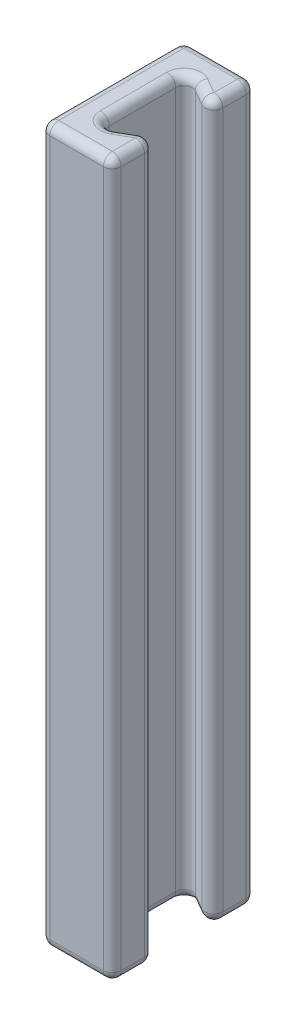
from build123d import *
from OCP.BRepFilletAPI import BRepFilletAPI_MakeFillet

# Parameters (mm, degrees)
BOSS_EXTRUDE2_DEPTH = 127
FILLET1_R1          = 1.5875
FILLET1_R2          = 1.4732


with BuildPart() as part:
    # Sketch1 → Boss-Extrude2 (new body)
    with BuildSketch(Plane(origin=(0, 0, 0), x_dir=(1, 0, 0), z_dir=(0, 1, 0))):
        Polygon((-28.067579909, 0), (-28.067579909, -25.4), (-15.367579909, -25.4), (-15.367579909, -16.933333333), (-22.699928279, -21.166666582), (-22.699928279, -4.233333249), (-15.367579909, -8.466666667), (-15.367579909, 0), align=None)
    extrude(amount=BOSS_EXTRUDE2_DEPTH)

    # Fillet1: one fillet with a radius per group of edges: ONE call of the kernel's fillet builder (fillet() takes one radius for all edges)
    fillet1_edges_1 = [part.edges().sort_by_distance(p)[0] for p in [
        (-19.033754094, 127, 6.349999958),
        (-22.699928279, 127, 12.699999915),
        (-19.033754094, 127, 19.049999958),
        (-15.367579909, 127, 21.166666667),
        (-15.367579909, 127, 4.233333333),
        (-21.717579909, 127, 0),
        (-28.067579909, 63.5, 0),
        (-15.367579909, 63.5, 0),
        (-21.717579909, 0, 0),
        (-15.367579909, 0, 4.233333333),
        (-15.367579909, 63.5, 8.466666667),
        (-15.367579909, 63.5, 16.933333333),
        (-15.367579909, 0, 21.166666667),
        (-15.367579909, 63.5, 25.4),
        (-22.699928279, 0, 12.699999915),
        (-28.067579909, 127, 12.7),
        (-21.717579909, 127, 25.4),
        (-28.067579909, 63.5, 25.4),
        (-28.067579909, 0, 12.7),
        (-21.717579909, 0, 25.4),
        (-19.033754094, 0, 6.349999958),
        (-19.033754094, 0, 19.049999958),
    ]]
    fillet1_edges_2 = [part.edges().sort_by_distance(p)[0] for p in [
        (-22.699928279, 63.5, 4.233333249),
        (-22.699928279, 63.5, 21.166666582),
    ]]
    fillet1 = BRepFilletAPI_MakeFillet(part.part.solid().wrapped)
    for e in fillet1_edges_1:
        fillet1.Add(FILLET1_R1, e.wrapped)
    for e in fillet1_edges_2:
        fillet1.Add(FILLET1_R2, e.wrapped)
    add(Compound.cast(fillet1.Shape()), mode=Mode.REPLACE)


solid = part.part
